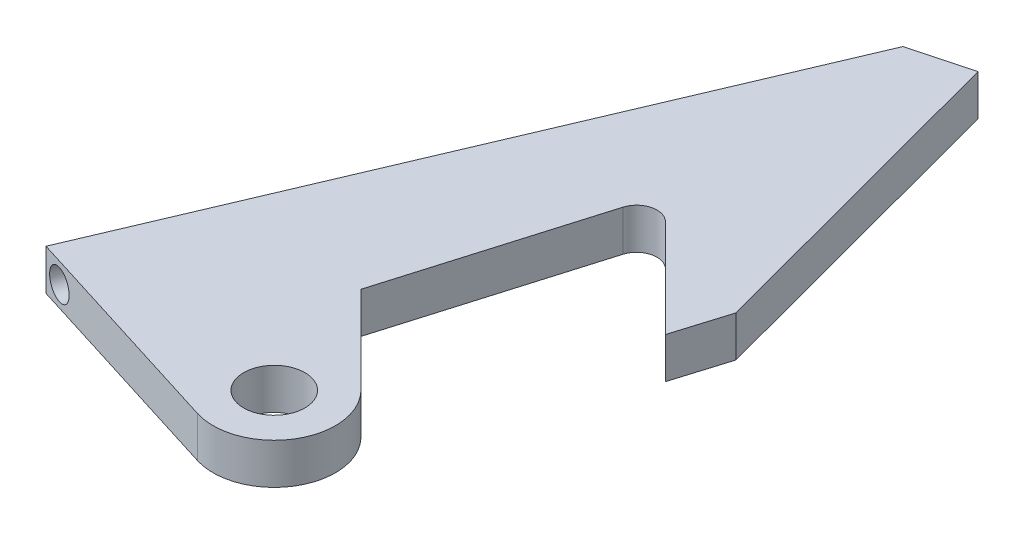
from build123d import *

# Parameters (mm, degrees)
SKETCH1_R                       = 4.7625
BOSS_EXTRUDE1_DEPTH             = 6.35
F_14_0_182_DIAMETER_HOLE1_D     = 4.6228
F_14_0_182_DIAMETER_HOLE1_DEPTH = 6.35
F_14_0_182_DIAMETER_HOLE1_TIP   = 1.388829235


with BuildPart() as part:
    # Sketch1 → Boss-Extrude1 (new body)
    with BuildSketch(Plane(origin=(0, 0, 0), x_dir=(1, 0, 0), z_dir=(0, 1, 0))):
        with BuildLine():
            Line((-2.715472603, -50.452570894), (-16.449210706, -36.716165316))
            Line((-16.449210706, -36.716165316), (-7.143929399, -5.302062091))
            ThreePointArc((-7.143929399, -5.302062091), (-4.881213446, -3.126502672), (-1.85461271, -3.95874678))
            Line((-1.85461271, -3.95874678), (13.315573809, -19.128933299))
            Line((13.315573809, -19.128933299), (15.879471691, -10.753687697))
            Line((15.879471691, -10.753687697), (2.2197595, 40.561165667))
            Line((2.2197595, 40.561165667), (-6.994225827, 38.108456959))
            Line((-6.994225827, 38.108456959), (-46.728023778, -55.399752843))
            Line((-46.728023778, -55.399752843), (-12.38156047, -66.157106701))
            ThreePointArc((-12.38156047, -66.157106701), (-1.47172138, -62.045085351), (-2.715472603, -50.452570894))
        make_face()
        with Locations((-9.583361485, -57.052398719)):
            Circle(SKETCH1_R, mode=Mode.SUBTRACT)
    extrude(amount=BOSS_EXTRUDE1_DEPTH)

    # #14 (0.182) Diameter Hole1
    with Locations(Plane(origin=(-19.975553156, 0, 63.778659005), x_dir=(0.9542892760421928, 0, 0.29888455569143674), z_dir=(-0.29888455569143674, 0, 0.9542892760421928))):
        with Locations((-24.858921468, 3.175)):
            Hole(F_14_0_182_DIAMETER_HOLE1_D / 2, depth=F_14_0_182_DIAMETER_HOLE1_DEPTH)
            with Locations((0, 0, -(F_14_0_182_DIAMETER_HOLE1_DEPTH + F_14_0_182_DIAMETER_HOLE1_TIP / 2))):  # 118° drill point
                Cone(0, F_14_0_182_DIAMETER_HOLE1_D / 2, F_14_0_182_DIAMETER_HOLE1_TIP, mode=Mode.SUBTRACT)


solid = part.part
